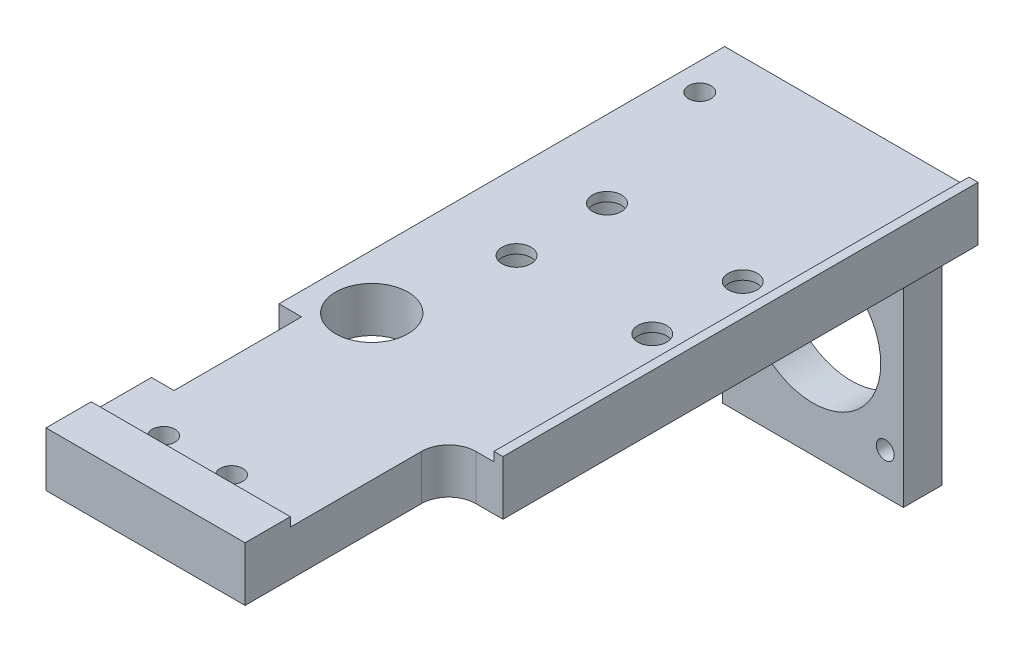
from build123d import *

# Parameters (mm, degrees)
BACK_SKETCH_R                                  = 0.8
BACK_SKETCH_R_2                                = 4
BACK_SKETCH_R_3                                = 1.25
BACK_EXTRUDE_DEPTH                             = 6
BOTTOM_SKETCH_W                                = 20
BOTTOM_SKETCH_H                                = 25
BOTTOM_SKETCH_R                                = 0.989941464
BOTTOM_SKETCH_R_2                              = 7.5
BOTTOM_EXTRUDE_DEPTH                           = 4.25
CARRAIGE_MOUNT_M3S_D                           = 3.2
CARRAIGE_MOUNT_M3S_CBORE_D                     = 6.5
CARRAIGE_MOUNT_M3S_CBORE_DEPTH                 = 4
ROTATIONAL_SENSOR_TAPPED_HOLES_M2_5X0_45_D     = 2.05
ROTATIONAL_SENSOR_TAPPED_HOLES_M2_5X0_45_DEPTH = 4
ROTATIONAL_SENSOR_TAPPED_HOLES_M2_5X0_45_TIP   = 0.615882135
M3X0_5_TAPPED_HOLE1_D                          = 2.5
SKETCH5_W                                      = 27
SKETCH5_H                                      = 70
CUT_EXTRUDE1_DEPTH                             = 1


with BuildPart() as part:
    # Back Sketch → Back Extrude (new body)
    with BuildSketch(Plane(origin=(0, 0, 0), x_dir=(1, 0, 0), z_dir=(0, 1, 0))):
        with BuildLine():
            Line((14, 4.25), (14, -48.25))
            Line((14, -48.25), (11, -48.25))
            ThreePointArc((11, -48.25), (8.878679656, -49.128679656), (8, -51.25))
            Line((8, -51.25), (8, -70.75))
            Line((8, -70.75), (-14, -70.75))
            Line((-14, -70.75), (-14, -59.1))
            Line((-14, -59.1), (-11.5, -59.1))
            Line((-11.5, -59.1), (-11.5, -45))
            Line((-11.5, -45), (-14, -45))
            Line((-14, -45), (-14, 4.25))
            Line((-14, 4.25), (14, 4.25))
        make_face()
        with Locations((9.5, -17.25)):
            Circle(BACK_SKETCH_R, mode=Mode.SUBTRACT)
        with Locations((-5.5, -17.25)):
            Circle(BACK_SKETCH_R, mode=Mode.SUBTRACT)
        with Locations((-5.5, -27.25)):
            Circle(BACK_SKETCH_R, mode=Mode.SUBTRACT)
        with Locations((9.5, -27.25)):
            Circle(BACK_SKETCH_R, mode=Mode.SUBTRACT)
        with Locations((-8, -40.75)):
            Circle(BACK_SKETCH_R_2, mode=Mode.SUBTRACT)
        with Locations((-7.75, -64)):
            Circle(BACK_SKETCH_R_3, mode=Mode.SUBTRACT)
        with Locations((-0.25, -64)):
            Circle(BACK_SKETCH_R_3, mode=Mode.SUBTRACT)
    extrude(amount=BACK_EXTRUDE_DEPTH)

    # Bottom Sketch → Bottom Extrude (add)
    with BuildSketch(Plane.XY):
        with Locations((0, -12.5)):
            Rectangle(BOTTOM_SKETCH_W, BOTTOM_SKETCH_H)
        with Locations((-8, -20.5)):
            Circle(BOTTOM_SKETCH_R, mode=Mode.SUBTRACT)
        with Locations((8, -20.5)):
            Circle(BOTTOM_SKETCH_R, mode=Mode.SUBTRACT)
        with Locations((-8, -4.5)):
            Circle(BOTTOM_SKETCH_R, mode=Mode.SUBTRACT)
        with Locations((0, -12.5)):
            Circle(BOTTOM_SKETCH_R_2, mode=Mode.SUBTRACT)
        with Locations((8, -4.5)):
            Circle(BOTTOM_SKETCH_R, mode=Mode.SUBTRACT)
    extrude(amount=-BOTTOM_EXTRUDE_DEPTH)

    # Carraige Mount  M3s (through all)
    with Locations(Plane(origin=(9.5, 0, 27.25), x_dir=(0, 0, -1), z_dir=(0, -1, 0))):
        with Locations((0, 0), (0, -15), (10, -15), (10, 0)):
            CounterBoreHole(CARRAIGE_MOUNT_M3S_D / 2, CARRAIGE_MOUNT_M3S_CBORE_D / 2, CARRAIGE_MOUNT_M3S_CBORE_DEPTH)

    # Rotational Sensor Tapped Holes M2.5x0.45 Tapped Holes
    with Locations(Plane.ZY.offset(11.5)):
        with Locations((55.25, 3.25), (48.25, 3.25)):
            Hole(ROTATIONAL_SENSOR_TAPPED_HOLES_M2_5X0_45_D / 2, depth=ROTATIONAL_SENSOR_TAPPED_HOLES_M2_5X0_45_DEPTH)
            with Locations((0, 0, -(ROTATIONAL_SENSOR_TAPPED_HOLES_M2_5X0_45_DEPTH + ROTATIONAL_SENSOR_TAPPED_HOLES_M2_5X0_45_TIP / 2))):  # 118° drill point
                Cone(0, ROTATIONAL_SENSOR_TAPPED_HOLES_M2_5X0_45_D / 2, ROTATIONAL_SENSOR_TAPPED_HOLES_M2_5X0_45_TIP, mode=Mode.SUBTRACT)

    # M3x0.5 Tapped Hole1 (through all)
    with Locations(Plane(origin=(0, 6, 0), x_dir=(1, 0, 0), z_dir=(0, 1, 0))):
        with Locations((-11, -1.5)):
            Hole(M3X0_5_TAPPED_HOLE1_D / 2)

    # Sketch5 → Cut-Extrude1 (cut)
    with BuildSketch(Plane(origin=(0, 6, 0), x_dir=(1, 0, 0), z_dir=(0, 1, 0))):
        with Locations((-0.5, -30.75)):
            Rectangle(SKETCH5_W, SKETCH5_H)
    extrude(amount=-CUT_EXTRUDE1_DEPTH, mode=Mode.SUBTRACT)


solid = part.part
